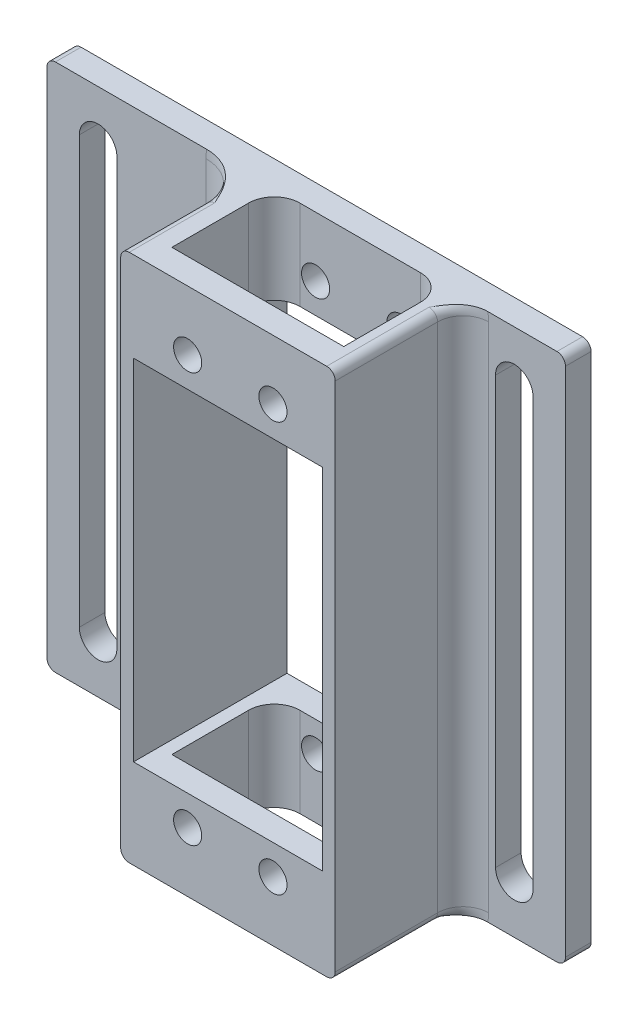
from build123d import *

# Parameters (mm, degrees)
SKETCH_1_W          = 60.8
SKETCH_1_H          = 62
EXTRUDE_1_DEPTH     = 3
SKETCH_2_W          = 25.15
SKETCH_2_H          = 62
SKETCH_2_R          = 1.65
EXTRUDE_2_DEPTH     = 15
CUT_EXTRUDE_START   = -45
SKETCH_4_R          = 1.65
SKETCH_4_W          = 22.15
SKETCH_4_H          = 41
CUT_EXTRUDE_4_DEPTH = 45
FILLET_1_R          = 1
FILLET_2_R          = 5
SKETCH_5_W          = 20.15
SKETCH_5_H          = 12
CUT_EXTRUDE_5_DEPTH = 70
FILLET_3_R          = 3
FILLET_4_R          = 3


with BuildPart() as part:
    # 草图1 → 凸台-拉伸1 (new body)
    with BuildSketch(Plane.XY):
        with Locations((4.6, -25)):
            Rectangle(SKETCH_1_W, SKETCH_1_H)
        with BuildLine():
            Line((26.8, 0), (26.8, -50))
            ThreePointArc((26.8, -50), (29, -52.2), (31.2, -50))
            Line((31.2, -50), (31.2, 0))
            ThreePointArc((31.2, 0), (29, 2.2), (26.8, 0))
        make_face(mode=Mode.SUBTRACT)
        with BuildLine():
            Line((-22, 0), (-22, -50))
            ThreePointArc((-22, -50), (-19.8, -52.2), (-17.6, -50))
            Line((-17.6, -50), (-17.6, 0))
            ThreePointArc((-17.6, 0), (-19.8, 2.2), (-22, 0))
        make_face(mode=Mode.SUBTRACT)
    extrude(amount=EXTRUDE_1_DEPTH)

    # 草图2 → 凸台-拉伸2 (add)
    with BuildSketch(Plane.XY.offset(3)):
        with Locations((10.425, -25)):
            Rectangle(SKETCH_2_W, SKETCH_2_H)
        with Locations((5.7, -1)):
            Circle(SKETCH_2_R, mode=Mode.SUBTRACT)
        with Locations((15.7, -1)):
            Circle(SKETCH_2_R, mode=Mode.SUBTRACT)
        with Locations((15.7, -49)):
            Circle(SKETCH_2_R, mode=Mode.SUBTRACT)
        with Locations((5.7, -49)):
            Circle(SKETCH_2_R, mode=Mode.SUBTRACT)
    extrude(amount=EXTRUDE_2_DEPTH)

    # 草图4 → 切除-拉伸4 (cut)
    with BuildSketch(Plane.XY.offset(18).offset(CUT_EXTRUDE_START)):
        with Locations((5.7, -1)):
            Circle(SKETCH_4_R)
        with Locations((5.7, -49)):
            Circle(SKETCH_4_R)
        with Locations((15.7, -49)):
            Circle(SKETCH_4_R)
        with Locations((15.7, -1)):
            Circle(SKETCH_4_R)
        with Locations((10.425, -25)):
            Rectangle(SKETCH_4_W, SKETCH_4_H)
    extrude(amount=CUT_EXTRUDE_4_DEPTH, mode=Mode.SUBTRACT)

    # 圆角1
    fillet_1_edges = [part.edges().sort_by_distance(p)[0] for p in [
        (-2.15, 6, 10.5),
        (-2.15, -56, 10.5),
        (23, -56, 10.5),
        (23, 6, 10.5),
        (-25.8, 6, 1.5),
        (35, 6, 1.5),
        (35, -56, 1.5),
        (-25.8, -56, 1.5),
    ]]
    fillet(fillet_1_edges, radius=FILLET_1_R)

    # 圆角2
    # the kernel refuses this fillet: 5 mm, written as the material it adds along each edge
    with BuildSketch(Plane(origin=(-2.15, -55, 3), x_dir=(0, 0, 1), z_dir=(0, 1, 0))) as fillet_2_piece_1:
        with BuildLine():
            CenterArc((FILLET_2_R, -FILLET_2_R), FILLET_2_R, 90, 90)
            Line((0, -FILLET_2_R), (0, 0))
            Line((0, 0), (FILLET_2_R, 0))
        make_face()
    extrude(amount=60)
    with BuildSketch(Plane(origin=(-1.15, 5, 3), x_dir=(-0.9999802608561372, -0.00628314396555929, 0), z_dir=(-0.00628314396555929, 0.9999802608561372, 0))) as fillet_2_piece_2_section:
        with BuildLine():
            CenterArc((-1 - FILLET_2_R, FILLET_2_R), FILLET_2_R, 270, 90)
            Line((-1 - FILLET_2_R, 0), (-1, 0))
            Line((-1, 0), (-1, FILLET_2_R))
        make_face()
    fillet_2_piece_2 = revolve(axis=Axis((-1.15, 5, 3), (0, 0, 1)), revolution_arc=359.64, mode=Mode.PRIVATE)
    fillet_2_piece_2 = split(fillet_2_piece_2, bisect_by=Plane(origin=(-1.917475006, 6, 5.017645517), z_dir=(0, -1, 0)), keep=Keep.TOP, mode=Mode.PRIVATE)
    add(fillet_2_piece_2)
    with BuildSketch(Plane(origin=(-1.15, -55, 3), x_dir=(-0.9999802608561372, 0.006283143965561067, 0), z_dir=(-0.006283143965561067, -0.9999802608561372, 0))) as fillet_2_piece_3_section:
        with BuildLine():
            CenterArc((-1 - FILLET_2_R, -FILLET_2_R), FILLET_2_R, 0, 90)
            Line((-1 - FILLET_2_R, 0), (-1, 0))
            Line((-1, 0), (-1, -FILLET_2_R))
        make_face()
    fillet_2_piece_3 = revolve(axis=Axis((-1.15, -55, 3), (0, 0, -1)), revolution_arc=359.64, mode=Mode.PRIVATE)
    fillet_2_piece_3 = split(fillet_2_piece_3, bisect_by=Plane(origin=(-1.917475041, -56, 5.017645533), z_dir=(0, 1, 0)), keep=Keep.TOP, mode=Mode.PRIVATE)
    add(fillet_2_piece_3)

    # 草图5 → 切除-拉伸5 (cut)
    with BuildSketch(Plane(origin=(0, -56, 0), x_dir=(-1, 0, 0), z_dir=(0, -1, 0))):
        with Locations((-10.925, -9)):
            Rectangle(SKETCH_5_W, SKETCH_5_H)
    extrude(amount=-CUT_EXTRUDE_5_DEPTH, mode=Mode.SUBTRACT)

    # 圆角3
    fillet_3_edges = [part.edges().sort_by_distance(p)[0] for p in [
        (0.85, 0.75, 3),
        (0.85, -50.75, 3),
        (21, 0.75, 3),
        (21, -50.75, 3),
    ]]
    fillet(fillet_3_edges, radius=FILLET_3_R)

    # 圆角4
    # the kernel refuses this fillet: 3 mm, written as the material it adds along each edge
    with BuildSketch(Plane(origin=(23, 5, 3), x_dir=(1, 0, 0), z_dir=(0, -1, 0))) as fillet_4_piece_1:
        with BuildLine():
            CenterArc((FILLET_4_R, FILLET_4_R), FILLET_4_R, 180, 90)
            Line((0, FILLET_4_R), (0, 0))
            Line((0, 0), (FILLET_4_R, 0))
        make_face()
    extrude(amount=60)
    with BuildSketch(Plane(origin=(22, 5, 3), x_dir=(0.9999802608561372, -0.0062831439655584, 0), z_dir=(0.0062831439655584, 0.9999802608561372, 0))) as fillet_4_piece_2_section:
        with BuildLine():
            CenterArc((-1 - FILLET_4_R, -FILLET_4_R), FILLET_4_R, 0, 90)
            Line((-1, -FILLET_4_R), (-1, 0))
            Line((-1, 0), (-1 - FILLET_4_R, 0))
        make_face()
    fillet_4_piece_2 = revolve(axis=Axis((22, 5, 3), (0, 0, -1)), revolution_arc=359.64, mode=Mode.PRIVATE)
    fillet_4_piece_2 = split(fillet_4_piece_2, bisect_by=Plane(origin=(22.764056833, 6, 4.135633633), z_dir=(0, -1, 0)), keep=Keep.TOP, mode=Mode.PRIVATE)
    add(fillet_4_piece_2)
    with BuildSketch(Plane(origin=(22, -55, 3), x_dir=(0.9999802608561372, 0.006283143965561065, 0), z_dir=(0.006283143965561065, -0.9999802608561372, 0))) as fillet_4_piece_3_section:
        with BuildLine():
            CenterArc((-1 - FILLET_4_R, FILLET_4_R), FILLET_4_R, 270, 90)
            Line((-1 - FILLET_4_R, 0), (-1, 0))
            Line((-1, 0), (-1, FILLET_4_R))
        make_face()
    fillet_4_piece_3 = revolve(axis=Axis((22, -55, 3), (0, 0, 1)), revolution_arc=359.64, mode=Mode.PRIVATE)
    fillet_4_piece_3 = split(fillet_4_piece_3, bisect_by=Plane(origin=(22.76405677, -56, 4.135633616), z_dir=(0, 1, 0)), keep=Keep.TOP, mode=Mode.PRIVATE)
    add(fillet_4_piece_3)


solid = part.part
